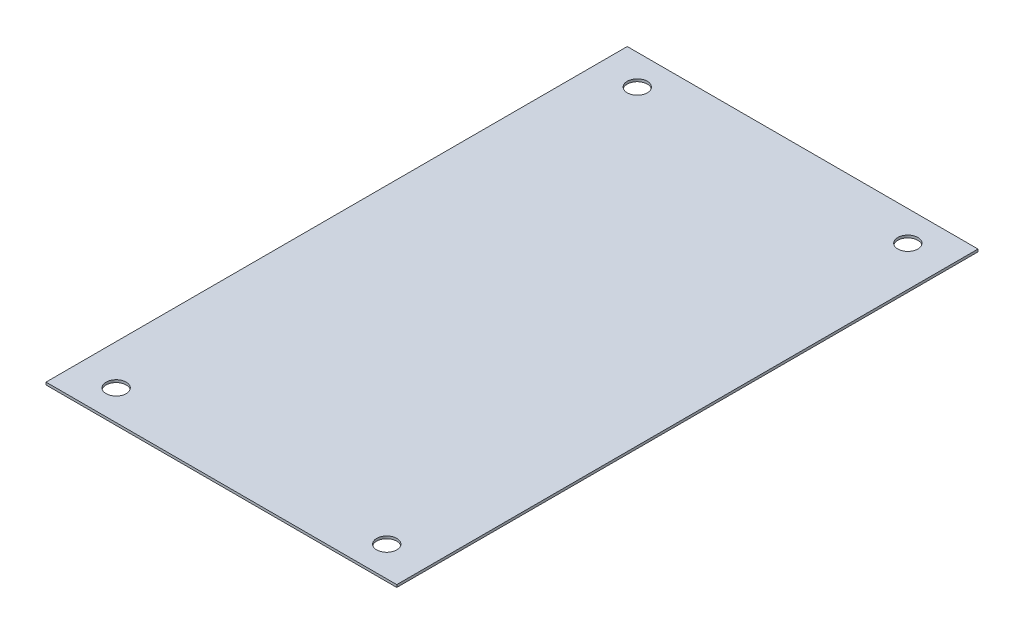
from build123d import *

# Parameters (mm, degrees)
SKETCH1_W                  = 444.5
SKETCH1_H                  = 736.6
BOSS_EXTRUDE1_DEPTH        = 3.175
F_1_1_DIAMETER_HOLE1_D     = 25.4
F_1_1_DIAMETER_HOLE1_DEPTH = 20.574
F_1_1_DIAMETER_HOLE1_TIP   = 7.630929862


with BuildPart() as part:
    # Sketch1 → Boss-Extrude1 (new body)
    with BuildSketch(Plane(origin=(0, 0, 0), x_dir=(1, 0, 0), z_dir=(0, 1, 0))):
        with Locations((222.25, 368.3)):
            Rectangle(SKETCH1_W, SKETCH1_H)
    extrude(amount=BOSS_EXTRUDE1_DEPTH)

    # 1 (1) Diameter Hole1
    with Locations(Plane(origin=(0, 3.175, 0), x_dir=(-1, 0, 0), z_dir=(0, 1, 0))):
        with Locations((-50.8, -38.1), (-50.8, -698.5), (-393.7, -698.5), (-393.7, -38.1)):
            Hole(F_1_1_DIAMETER_HOLE1_D / 2, depth=F_1_1_DIAMETER_HOLE1_DEPTH)
            with Locations((0, 0, -(F_1_1_DIAMETER_HOLE1_DEPTH + F_1_1_DIAMETER_HOLE1_TIP / 2))):  # 118° drill point
                Cone(0, F_1_1_DIAMETER_HOLE1_D / 2, F_1_1_DIAMETER_HOLE1_TIP, mode=Mode.SUBTRACT)


solid = part.part
